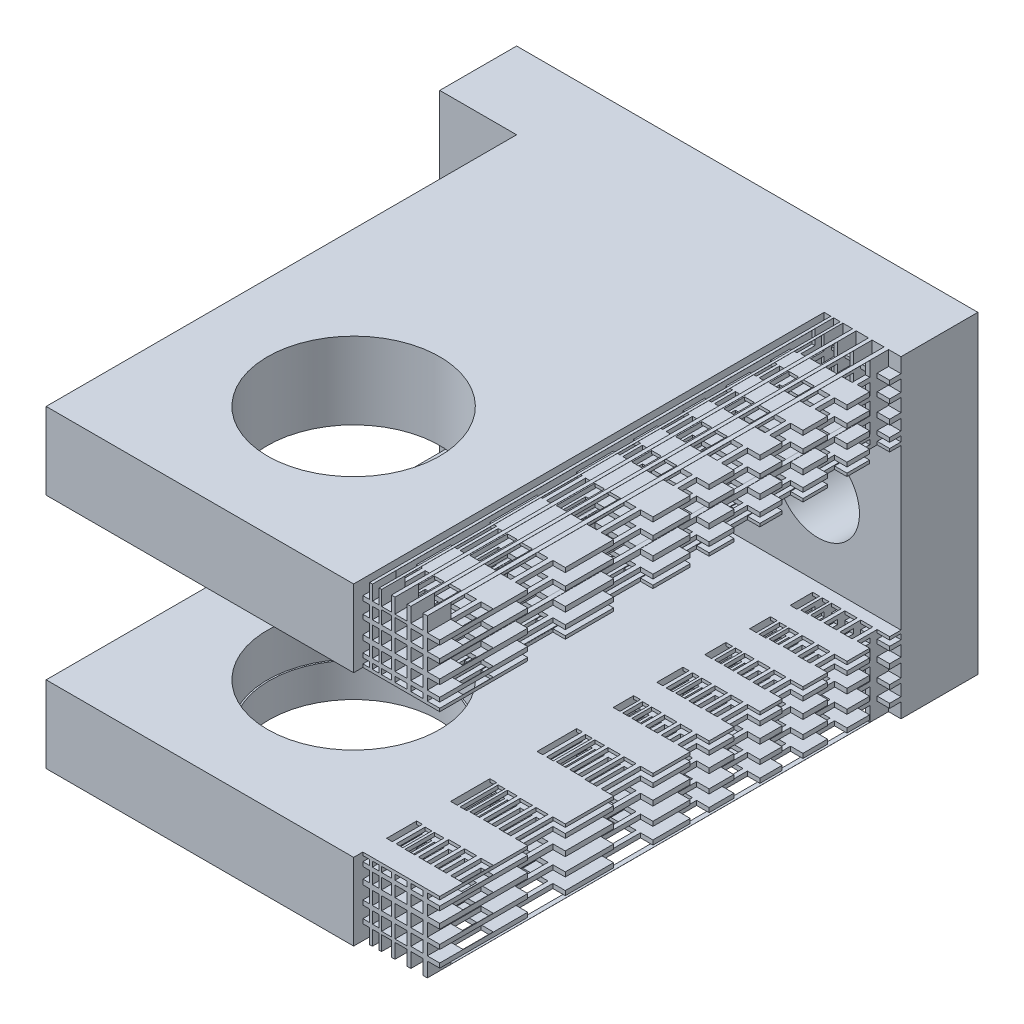
from build123d import *

# Parameters (mm, degrees)
SKETCH1_W               = 12.7
SKETCH1_H               = 22.606
SKETCH1_R               = 3.556
BOSS_EXTRUDE1_DEPTH     = 3.175
SKETCH2_W               = 3.175
SKETCH2_H               = 3.175
BOSS_EXTRUDE2_DEPTH     = 3.175
SKETCH3_W               = 3.175
SKETCH3_H               = 3.175
BOSS_EXTRUDE3_DEPTH     = 3.175
SKETCH4_W               = 19.05
SKETCH4_H               = 3.175
BOSS_EXTRUDE4_DEPTH     = 6.604
BOSS_EXTRUDE5_START     = 1.778
SKETCH5_R               = 3.556
BOSS_EXTRUDE5_DEPTH     = 1.778
SKETCH6_R               = 3.4925
BOSS_EXTRUDE6_DEPTH     = 1.397
HOLE1_D                 = 3.429
HOLE1_DEPTH             = 22.606025
HOLE2_D                 = 3.429
HOLE2_DEPTH             = 22.606025
SKETCH16_W              = 0.494969521
SKETCH16_H              = 0.483458602
SKETCH16_H_2            = 0.541013197
SKETCH16_H_3            = 0.448925845
SKETCH16_H_4            = 0.218707463
SKETCH16_W_2            = 0.506480441
SKETCH16_H_5            = 0.548937718
SKETCH16_W_3            = 0.402882168
SKETCH16_W_4            = 0.276262058
BOSS_EXTRUDE8_DEPTH     = 19.05
SKETCH17_W              = 0.278674662
SKETCH17_H              = 0.932497652
SKETCH17_W_2            = 0.276262058
SKETCH17_H_2            = 0.88236337
SKETCH17_W_3            = 0.402882168
SKETCH17_H_3            = 0.862309657
SKETCH17_W_4            = 0.506480441
SKETCH17_H_4            = 0.85618516
SKETCH17_W_5            = 0.494969521
SKETCH17_H_5            = 0.852906976
SKETCH17_W_6            = 0.513565086
SKETCH17_H_6            = 0.827179786
SKETCH17_H_7            = 0.862592562
SKETCH17_H_8            = 0.845678983
SKETCH17_H_9            = 0.811851823
SKETCH17_H_10           = 0.786481454
SKETCH17_H_11           = 0.828765403
SKETCH17_H_12           = 0.803395034
SKETCH17_H_13           = 0.871049352
SKETCH17_H_14           = 0.860585338
SKETCH17_H_15           = 0.868718813
SKETCH17_H_16           = 0.871996997
SKETCH17_H_17           = 0.85774822
SKETCH17_W_7            = 0.250199404
SKETCH17_H_18           = 1.0822681
SKETCH17_H_19           = 1.090167867
SKETCH17_H_20           = 1.077277477
SKETCH17_H_21           = 1.086750068
SKETCH17_H_22           = 1.068458167
SKETCH17_H_23           = 1.07480807
SKETCH17_H_24           = 0.843810764
SKETCH17_H_25           = 0.812939639
SKETCH17_H_26           = 0.818084826
SKETCH17_H_27           = 0.802649263
SKETCH17_H_28           = 0.792358888
SKETCH17_H_29           = 0.77733494
SKETCH17_W_8            = 0.233703892
SKETCH17_H_30           = 1.636651006
SKETCH17_H_31           = 1.611853264
SKETCH17_H_32           = 1.587055522
SKETCH17_H_33           = 1.624252135
SKETCH17_W_9            = 0.511117341
SKETCH17_H_34           = 1.549858907
SKETCH17_H_35           = 1.537460036
SKETCH17_H_36           = 1.525061165
SKETCH17_H_37           = 1.549858908
SKETCH17_H_38           = 1.574656651
SKETCH17_H_39           = 1.624252136
SKETCH17_W_10           = 0.23933235
SKETCH17_H_40           = 1.240686471
SKETCH17_H_41           = 1.200338944
SKETCH17_H_42           = 1.210425826
SKETCH17_H_43           = 1.250773353
SKETCH17_W_11           = 0.503093181
CUT_EXTRUDE2_DEPTH      = 3.81
SKETCH18_W              = 1.052143956
SKETCH18_H              = 0.603912665
SKETCH18_W_2            = 1.053260651
SKETCH18_H_2            = 0.483458602
SKETCH18_W_3            = 1.058636326
SKETCH18_H_3            = 0.532661977
SKETCH18_H_4            = 0.448925845
SKETCH18_W_4            = 1.07170591
SKETCH18_H_5            = 0.18882497
CUT_EXTRUDE3_DEPTH      = 2.413
LPATTERN4_START         = 12.345829178
LPATTERN4_OUTLINE_W     = 0.184174705
LPATTERN4_OUTLINE_H     = 16.256
LPATTERN4_OUTLINE_W_2   = 0.149641948
LPATTERN4_OUTLINE_W_3   = 0.103598272
LPATTERN4_OUTLINE_W_4   = 0.115109191
LPATTERN4_DEPTH         = 0.603912665
LPATTERN4_START_2       = 10.961359188
LPATTERN4_2_OUTLINE_W   = 0.184174705
LPATTERN4_2_OUTLINE_H   = 16.256
LPATTERN4_2_OUTLINE_W_2 = 0.149641948
LPATTERN4_2_OUTLINE_W_3 = 0.103598272
LPATTERN4_2_OUTLINE_W_4 = 0.115109191
LPATTERN4_2_DEPTH       = 0.532661977
LPATTERN4_START_3       = 11.678195871
LPATTERN4_3_OUTLINE_W   = 0.184174705
LPATTERN4_3_OUTLINE_H   = 16.256
LPATTERN4_3_OUTLINE_W_2 = 0.149641948
LPATTERN4_3_OUTLINE_W_3 = 0.103598272
LPATTERN4_3_OUTLINE_W_4 = 0.115109191
LPATTERN4_3_DEPTH       = 0.483458602
LPATTERN4_START_4       = 10.296885579
LPATTERN4_4_OUTLINE_W   = 0.184174705
LPATTERN4_4_OUTLINE_H   = 16.256
LPATTERN4_4_OUTLINE_W_2 = 0.149641948
LPATTERN4_4_OUTLINE_W_3 = 0.103598272
LPATTERN4_4_OUTLINE_W_4 = 0.115109191
LPATTERN4_4_DEPTH       = 0.448925845
LPATTERN4_START_5       = 9.935396823
LPATTERN4_5_OUTLINE_W   = 0.184174705
LPATTERN4_5_OUTLINE_H   = 16.256
LPATTERN4_5_OUTLINE_W_2 = 0.149641948
LPATTERN4_5_OUTLINE_W_3 = 0.103598272
LPATTERN4_5_OUTLINE_W_4 = 0.115109191
LPATTERN4_5_DEPTH       = 0.18882497


with BuildPart() as part:
    # Sketch1 → Boss-Extrude1 (new body)
    with BuildSketch(Plane.XZ.offset(-9.779)):
        Rectangle(SKETCH1_W, SKETCH1_H)
        with Locations(Location((0, 4.953, 0), (0, 0, 90))):
            Circle(SKETCH1_R, mode=Mode.SUBTRACT)
    extrude(amount=-BOSS_EXTRUDE1_DEPTH)

    # Sketch2 → Boss-Extrude2 (add)
    with BuildSketch(Plane.ZY.offset(6.35)):
        with Locations((-9.7155, 11.3665)):
            Rectangle(SKETCH2_W, SKETCH2_H)
    extrude(amount=BOSS_EXTRUDE2_DEPTH)

    # Sketch3 → Boss-Extrude3 (add)
    with BuildSketch(Plane(origin=(6.35, 0, 0), x_dir=(0, 0, -1), z_dir=(1, 0, 0))):
        with Locations((9.7155, 11.3665)):
            Rectangle(SKETCH3_W, SKETCH3_H)
    extrude(amount=BOSS_EXTRUDE3_DEPTH)

    # Sketch4 → Boss-Extrude4 (add)
    with BuildSketch(Plane.XZ.offset(-9.779)):
        with Locations((0, -9.7155)):
            Rectangle(SKETCH4_W, SKETCH4_H)
    extrude(amount=BOSS_EXTRUDE4_DEPTH)

    # Sketch5 → Boss-Extrude5 (add)
    with BuildSketch(Plane.XZ.offset(-3.175).offset(BOSS_EXTRUDE5_START)):
        Polygon((-6.35, 11.303), (6.35, 11.303), (6.35, -8.128), (9.525, -8.128), (9.525, -11.303), (-9.525, -11.303), (-9.525, -8.128), (-6.35, -8.128), align=None)
        with Locations(Location((0, 4.953, 0), (0, 0, 90))):
            Circle(SKETCH5_R, mode=Mode.SUBTRACT)
    extrude(amount=-BOSS_EXTRUDE5_DEPTH)

    # Sketch6 → Boss-Extrude6 (add)
    with BuildSketch(Plane.XZ.offset(-1.397)):
        Polygon((-9.525, -8.128), (-6.35, -8.128), (-6.35, 11.303), (6.35, 11.303), (6.35, -8.128), (9.525, -8.128), (9.525, -11.303), (-9.525, -11.303), align=None)
        with Locations(Location((0, 4.953, 0), (0, 0, 270))):
            Circle(SKETCH6_R, mode=Mode.SUBTRACT)
    extrude(amount=BOSS_EXTRUDE6_DEPTH)

    # Hole1
    with Locations(Plane(origin=(0, 0, -11.303), x_dir=(-1, 0, 0), z_dir=(0, 0, -1))):
        with Locations((-6.096, 6.477)):
            Hole(HOLE1_D / 2, depth=HOLE1_DEPTH)

    # Hole2
    with Locations(Plane(origin=(0, 0, -11.303), x_dir=(-1, 0, 0), z_dir=(0, 0, -1))):
        with Locations((6.096, 6.477)):
            Hole(HOLE2_D / 2, depth=HOLE2_DEPTH)

    # Sketch16 → Boss-Extrude8 (add)
    with BuildSketch(Plane.XY.offset(-8.128)):
        Polygon((6.628674662, 12.954), (6.628674662, 12.345829178), (6.35, 12.345829178), (6.35, 12.161654473), (6.628674662, 12.161654473), (6.628674662, 11.678195871), (6.35, 11.678195871), (6.35, 11.494021165), (6.628674662, 11.494021165), (6.628674662, 10.953007968), (6.35, 10.953007968), (6.35, 10.745811424), (6.628674662, 10.745811424), (6.628674662, 10.296885579), (6.35, 10.296885579), (6.35, 10.124221793), (6.628674662, 10.124221793), (6.628674662, 9.90551433), (6.35, 9.90551433), (6.35, 9.779), (9.525, 9.779), (9.525, 9.90551433), (9.011434914, 9.90551433), (9.011434914, 10.124221793), (9.525, 10.124221793), (9.525, 10.296885579), (9.011434914, 10.296885579), (9.011434914, 10.745811424), (9.525, 10.745811424), (9.525, 10.953007968), (9.011434914, 10.953007968), (9.011434914, 11.494021165), (9.525, 11.494021165), (9.525, 11.678195871), (9.011434914, 11.678195871), (9.011434914, 12.161654473), (9.525, 12.161654473), (9.525, 12.345829178), (9.011434914, 12.345829178), (9.011434914, 12.954), (8.827260209, 12.954), (8.827260209, 12.345829178), (8.332290688, 12.345829178), (8.332290688, 12.954), (8.18264874, 12.954), (8.18264874, 12.345829178), (7.676168299, 12.345829178), (7.676168299, 12.954), (7.526526351, 12.954), (7.526526351, 12.345829178), (7.123644183, 12.345829178), (7.123644183, 12.954), (7.020045911, 12.954), (7.020045911, 12.345829178), (6.743783853, 12.345829178), (6.743783853, 12.954), align=None)
        with Locations((8.579775449, 11.919925172)):
            Rectangle(SKETCH16_W, SKETCH16_H, mode=Mode.SUBTRACT)
        with Locations((8.579775449, 11.223514567)):
            Rectangle(SKETCH16_W, SKETCH16_H_2, mode=Mode.SUBTRACT)
        with Locations((8.579775449, 10.521348502)):
            Rectangle(SKETCH16_W, SKETCH16_H_3, mode=Mode.SUBTRACT)
        with Locations((8.579775449, 10.014868061)):
            Rectangle(SKETCH16_W, SKETCH16_H_4, mode=Mode.SUBTRACT)
        with Locations((7.92940852, 11.95266473)):
            Rectangle(SKETCH16_W_2, SKETCH16_H_5, mode=Mode.SUBTRACT)
        with Locations((7.92940852, 11.223514567)):
            Rectangle(SKETCH16_W_2, SKETCH16_H_2, mode=Mode.SUBTRACT)
        with Locations((7.92940852, 10.521348502)):
            Rectangle(SKETCH16_W_2, SKETCH16_H_3, mode=Mode.SUBTRACT)
        with Locations((7.92940852, 10.014868061)):
            Rectangle(SKETCH16_W_2, SKETCH16_H_4, mode=Mode.SUBTRACT)
        with Locations((7.325085267, 11.95266473)):
            Rectangle(SKETCH16_W_3, SKETCH16_H_5, mode=Mode.SUBTRACT)
        with Locations((7.325085267, 11.223514567)):
            Rectangle(SKETCH16_W_3, SKETCH16_H_2, mode=Mode.SUBTRACT)
        with Locations((7.325085267, 10.521348502)):
            Rectangle(SKETCH16_W_3, SKETCH16_H_3, mode=Mode.SUBTRACT)
        with Locations((7.325085267, 10.014868061)):
            Rectangle(SKETCH16_W_3, SKETCH16_H_4, mode=Mode.SUBTRACT)
        with Locations((6.881914882, 11.919925172)):
            Rectangle(SKETCH16_W_4, SKETCH16_H, mode=Mode.SUBTRACT)
        with Locations((6.881914882, 11.223514567)):
            Rectangle(SKETCH16_W_4, SKETCH16_H_2, mode=Mode.SUBTRACT)
        with Locations((6.881914882, 10.521348502)):
            Rectangle(SKETCH16_W_4, SKETCH16_H_3, mode=Mode.SUBTRACT)
        with Locations((6.881914882, 10.014868061)):
            Rectangle(SKETCH16_W_4, SKETCH16_H_4, mode=Mode.SUBTRACT)
    boss_extrude8 = extrude(amount=BOSS_EXTRUDE8_DEPTH)

    # Sketch17 → Cut-Extrude2 (cut)
    with BuildSketch(Plane(origin=(0, 12.954, 0), x_dir=(1, 0, 0), z_dir=(0, 1, 0))):
        with Locations((6.489337331, 7.192044527)):
            Rectangle(SKETCH17_W, SKETCH17_H)
        with Locations((6.881914882, 7.217111668)):
            Rectangle(SKETCH17_W_2, SKETCH17_H_2)
        with Locations((7.325085267, 7.227138525)):
            Rectangle(SKETCH17_W_3, SKETCH17_H_3)
        with Locations((7.92940852, 7.230200773)):
            Rectangle(SKETCH17_W_4, SKETCH17_H_4)
        with Locations((8.579775449, 7.231839865)):
            Rectangle(SKETCH17_W_5, SKETCH17_H_5)
        with Locations((9.268217457, 7.24470346)):
            Rectangle(SKETCH17_W_6, SKETCH17_H_6)
        with Locations((6.489337331, 5.48250213)):
            Rectangle(SKETCH17_W, SKETCH17_H_7)
        with Locations((6.881914882, 5.474045341)):
            Rectangle(SKETCH17_W_2, SKETCH17_H_8)
        with Locations((7.325085267, 5.490958921)):
            Rectangle(SKETCH17_W_3, SKETCH17_H_9)
        with Locations((7.92940852, 5.503644105)):
            Rectangle(SKETCH17_W_4, SKETCH17_H_10)
        with Locations((8.579775449, 5.482502131)):
            Rectangle(SKETCH17_W_5, SKETCH17_H_11)
        with Locations((9.268217457, 5.495187315)):
            Rectangle(SKETCH17_W_6, SKETCH17_H_12)
        with Locations((6.489337331, 3.634693554)):
            Rectangle(SKETCH17_W, SKETCH17_H_13)
        with Locations((6.881914882, 3.638921949)):
            Rectangle(SKETCH17_W_2, SKETCH17_H_7)
        with Locations((7.325085267, 3.639925561)):
            Rectangle(SKETCH17_W_3, SKETCH17_H_14)
        with Locations((7.92940852, 3.643992299)):
            Rectangle(SKETCH17_W_4, SKETCH17_H_15)
        with Locations((8.579775449, 3.642353207)):
            Rectangle(SKETCH17_W_5, SKETCH17_H_16)
        with Locations((9.268217457, 3.649477595)):
            Rectangle(SKETCH17_W_6, SKETCH17_H_17)
        with Locations((6.475099702, 1.759319703)):
            Rectangle(SKETCH17_W_7, SKETCH17_H_18)
        with Locations((6.881914882, 1.75536982)):
            Rectangle(SKETCH17_W_2, SKETCH17_H_19)
        with Locations((7.325085267, 1.761815015)):
            Rectangle(SKETCH17_W_3, SKETCH17_H_20)
        with Locations((7.92940852, 1.757078719)):
            Rectangle(SKETCH17_W_4, SKETCH17_H_21)
        with Locations((8.579775449, 1.76622467)):
            Rectangle(SKETCH17_W_5, SKETCH17_H_22)
        with Locations((9.268217457, 1.763049718)):
            Rectangle(SKETCH17_W_6, SKETCH17_H_23)
        with Locations((6.489337331, -0.159569393)):
            Rectangle(SKETCH17_W, SKETCH17_H_24)
        with Locations((6.881914882, -0.175004956)):
            Rectangle(SKETCH17_W_2, SKETCH17_H_25)
        with Locations((7.325085267, -0.177577549)):
            Rectangle(SKETCH17_W_3, SKETCH17_H_26)
        with Locations((7.92940852, -0.18529533)):
            Rectangle(SKETCH17_W_4, SKETCH17_H_27)
        with Locations((8.579775449, -0.180150143)):
            Rectangle(SKETCH17_W_5, SKETCH17_H_28)
        with Locations((9.268217457, -0.187662117)):
            Rectangle(SKETCH17_W_6, SKETCH17_H_29)
        with Locations((6.466851946, -2.910632303)):
            Rectangle(SKETCH17_W_8, SKETCH17_H_30)
        with Locations((6.881914882, -2.923031174)):
            Rectangle(SKETCH17_W_2, SKETCH17_H_31)
        with Locations((7.325085267, -2.910632303)):
            Rectangle(SKETCH17_W_3, SKETCH17_H_32)
        with Locations((7.92940852, -2.910632303)):
            Rectangle(SKETCH17_W_4, SKETCH17_H_32)
        with Locations((8.579775449, -2.92923061)):
            Rectangle(SKETCH17_W_5, SKETCH17_H_33)
        with Locations((9.268217457, -2.92923061)):
            Rectangle(SKETCH17_W_6, SKETCH17_H_33)
        with Locations((9.26944133, -6.512504405)):
            Rectangle(SKETCH17_W_9, SKETCH17_H_34)
        with Locations((8.579775449, -6.51870384)):
            Rectangle(SKETCH17_W_5, SKETCH17_H_35)
        with Locations((7.92940852, -6.512504405)):
            Rectangle(SKETCH17_W_4, SKETCH17_H_36)
        with Locations((7.325085267, -6.500105533)):
            Rectangle(SKETCH17_W_3, SKETCH17_H_37)
        with Locations((6.881914882, -6.512504405)):
            Rectangle(SKETCH17_W_2, SKETCH17_H_38)
        with Locations((6.489337331, -6.487706662)):
            Rectangle(SKETCH17_W, SKETCH17_H_39)
        with Locations((6.469666175, -9.32283019)):
            Rectangle(SKETCH17_W_10, SKETCH17_H_40)
        with Locations((6.881914882, -9.343003953)):
            Rectangle(SKETCH17_W_2, SKETCH17_H_41)
        with Locations((7.325085267, -9.348047394)):
            Rectangle(SKETCH17_W_3, SKETCH17_H_42)
        with Locations((7.92940852, -9.327873631)):
            Rectangle(SKETCH17_W_4, SKETCH17_H_43)
        with Locations((8.579775449, -9.327873631)):
            Rectangle(SKETCH17_W_5, SKETCH17_H_43)
        with Locations((9.262981505, -9.327873631)):
            Rectangle(SKETCH17_W_11, SKETCH17_H_43)
    cut_extrude2 = extrude(amount=-CUT_EXTRUDE2_DEPTH, mode=Mode.SUBTRACT)

    # Sketch18 → Cut-Extrude3 (cut)
    with BuildSketch(Plane(origin=(9.011434914, 0, 0), x_dir=(0, 0, -1), z_dir=(1, 0, 0))):
        with Locations((-9.427188329, 12.647785511)):
            Rectangle(SKETCH18_W, SKETCH18_H)
        with Locations((-9.426629981, 11.919925172)):
            Rectangle(SKETCH18_W_2, SKETCH18_H_2)
        with Locations((-9.429317819, 11.227690177)):
            Rectangle(SKETCH18_W_3, SKETCH18_H_3)
        with Locations((-9.426629981, 10.521348502)):
            Rectangle(SKETCH18_W_2, SKETCH18_H_4)
        with Locations((-9.435852611, 10.029809308)):
            Rectangle(SKETCH18_W_4, SKETCH18_H_5)
    cut_extrude3 = extrude(amount=-CUT_EXTRUDE3_DEPTH, mode=Mode.SUBTRACT)

    # LPattern4: read off the stored shape, not the designer's step
    # LPattern4 outline → LPattern4 (cut)
    with BuildSketch(Plane(origin=(0, 0, 0), x_dir=(1, 0, 0), z_dir=(0, 1, 0)).offset(LPATTERN4_START)):
        with Locations((8.919347562, -0.773116351)):
            Rectangle(LPATTERN4_OUTLINE_W, LPATTERN4_OUTLINE_H)
        with Locations((8.257469714, -0.773116351)):
            Rectangle(LPATTERN4_OUTLINE_W_2, LPATTERN4_OUTLINE_H)
        with Locations((7.601347325, -0.773116351)):
            Rectangle(LPATTERN4_OUTLINE_W_2, LPATTERN4_OUTLINE_H)
        with Locations((7.071845047, -0.773116351)):
            Rectangle(LPATTERN4_OUTLINE_W_3, LPATTERN4_OUTLINE_H)
        with Locations((6.686229258, -0.773116351)):
            Rectangle(LPATTERN4_OUTLINE_W_4, LPATTERN4_OUTLINE_H)
    lpattern4 = extrude(amount=LPATTERN4_DEPTH, mode=Mode.SUBTRACT)

    # LPattern4 2 outline → LPattern4 2 (cut)
    with BuildSketch(Plane(origin=(0, 0, 0), x_dir=(1, 0, 0), z_dir=(0, 1, 0)).offset(LPATTERN4_START_2)):
        with Locations((8.919347562, -0.771999656)):
            Rectangle(LPATTERN4_2_OUTLINE_W, LPATTERN4_2_OUTLINE_H)
        with Locations((8.257469714, -0.771999656)):
            Rectangle(LPATTERN4_2_OUTLINE_W_2, LPATTERN4_2_OUTLINE_H)
        with Locations((7.601347325, -0.771999656)):
            Rectangle(LPATTERN4_2_OUTLINE_W_2, LPATTERN4_2_OUTLINE_H)
        with Locations((7.071845047, -0.771999656)):
            Rectangle(LPATTERN4_2_OUTLINE_W_3, LPATTERN4_2_OUTLINE_H)
        with Locations((6.686229258, -0.771999656)):
            Rectangle(LPATTERN4_2_OUTLINE_W_4, LPATTERN4_2_OUTLINE_H)
    lpattern4_2 = extrude(amount=LPATTERN4_2_DEPTH, mode=Mode.SUBTRACT)

    # LPattern4 3 outline → LPattern4 3 (cut)
    with BuildSketch(Plane(origin=(0, 0, 0), x_dir=(1, 0, 0), z_dir=(0, 1, 0)).offset(LPATTERN4_START_3)):
        with Locations((8.919347562, -0.771999656)):
            Rectangle(LPATTERN4_3_OUTLINE_W, LPATTERN4_3_OUTLINE_H)
        with Locations((8.257469714, -0.771999656)):
            Rectangle(LPATTERN4_3_OUTLINE_W_2, LPATTERN4_3_OUTLINE_H)
        with Locations((7.601347325, -0.771999656)):
            Rectangle(LPATTERN4_3_OUTLINE_W_2, LPATTERN4_3_OUTLINE_H)
        with Locations((7.071845047, -0.771999656)):
            Rectangle(LPATTERN4_3_OUTLINE_W_3, LPATTERN4_3_OUTLINE_H)
        with Locations((6.686229258, -0.771999656)):
            Rectangle(LPATTERN4_3_OUTLINE_W_4, LPATTERN4_3_OUTLINE_H)
    lpattern4_3 = extrude(amount=LPATTERN4_3_DEPTH, mode=Mode.SUBTRACT)

    # LPattern4 4 outline → LPattern4 4 (cut)
    with BuildSketch(Plane(origin=(0, 0, 0), x_dir=(1, 0, 0), z_dir=(0, 1, 0)).offset(LPATTERN4_START_4)):
        with Locations((8.919347562, -0.771999656)):
            Rectangle(LPATTERN4_4_OUTLINE_W, LPATTERN4_4_OUTLINE_H)
        with Locations((8.257469714, -0.771999656)):
            Rectangle(LPATTERN4_4_OUTLINE_W_2, LPATTERN4_4_OUTLINE_H)
        with Locations((7.601347325, -0.771999656)):
            Rectangle(LPATTERN4_4_OUTLINE_W_2, LPATTERN4_4_OUTLINE_H)
        with Locations((7.071845047, -0.771999656)):
            Rectangle(LPATTERN4_4_OUTLINE_W_3, LPATTERN4_4_OUTLINE_H)
        with Locations((6.686229258, -0.771999656)):
            Rectangle(LPATTERN4_4_OUTLINE_W_4, LPATTERN4_4_OUTLINE_H)
    lpattern4_4 = extrude(amount=LPATTERN4_4_DEPTH, mode=Mode.SUBTRACT)

    # LPattern4 5 outline → LPattern4 5 (cut)
    with BuildSketch(Plane(origin=(0, 0, 0), x_dir=(1, 0, 0), z_dir=(0, 1, 0)).offset(LPATTERN4_START_5)):
        with Locations((8.919347562, -0.771999656)):
            Rectangle(LPATTERN4_5_OUTLINE_W, LPATTERN4_5_OUTLINE_H)
        with Locations((8.257469714, -0.771999656)):
            Rectangle(LPATTERN4_5_OUTLINE_W_2, LPATTERN4_5_OUTLINE_H)
        with Locations((7.601347325, -0.771999656)):
            Rectangle(LPATTERN4_5_OUTLINE_W_2, LPATTERN4_5_OUTLINE_H)
        with Locations((7.071845047, -0.771999656)):
            Rectangle(LPATTERN4_5_OUTLINE_W_3, LPATTERN4_5_OUTLINE_H)
        with Locations((6.686229258, -0.771999656)):
            Rectangle(LPATTERN4_5_OUTLINE_W_4, LPATTERN4_5_OUTLINE_H)
    lpattern4_5 = extrude(amount=LPATTERN4_5_DEPTH, mode=Mode.SUBTRACT)

    # Mirror1: Boss-Extrude8, Cut-Extrude2, Cut-Extrude3, LPattern4, LPattern4 2, LPattern4 3, LPattern4 4, LPattern4 5 across plane
    add(boss_extrude8.mirror(Plane(origin=(0, 6.477, 0), x_dir=(0, 0, 1), z_dir=(0, -1, 0))))
    add(cut_extrude2.mirror(Plane(origin=(0, 6.477, 0), x_dir=(0, 0, 1), z_dir=(0, -1, 0))), mode=Mode.SUBTRACT)
    add(cut_extrude3.mirror(Plane(origin=(0, 6.477, 0), x_dir=(0, 0, 1), z_dir=(0, -1, 0))), mode=Mode.SUBTRACT)
    add(lpattern4.mirror(Plane(origin=(0, 6.477, 0), x_dir=(0, 0, 1), z_dir=(0, -1, 0))), mode=Mode.SUBTRACT)
    add(lpattern4_2.mirror(Plane(origin=(0, 6.477, 0), x_dir=(0, 0, 1), z_dir=(0, -1, 0))), mode=Mode.SUBTRACT)
    add(lpattern4_3.mirror(Plane(origin=(0, 6.477, 0), x_dir=(0, 0, 1), z_dir=(0, -1, 0))), mode=Mode.SUBTRACT)
    add(lpattern4_4.mirror(Plane(origin=(0, 6.477, 0), x_dir=(0, 0, 1), z_dir=(0, -1, 0))), mode=Mode.SUBTRACT)
    add(lpattern4_5.mirror(Plane(origin=(0, 6.477, 0), x_dir=(0, 0, 1), z_dir=(0, -1, 0))), mode=Mode.SUBTRACT)


solid = part.part
